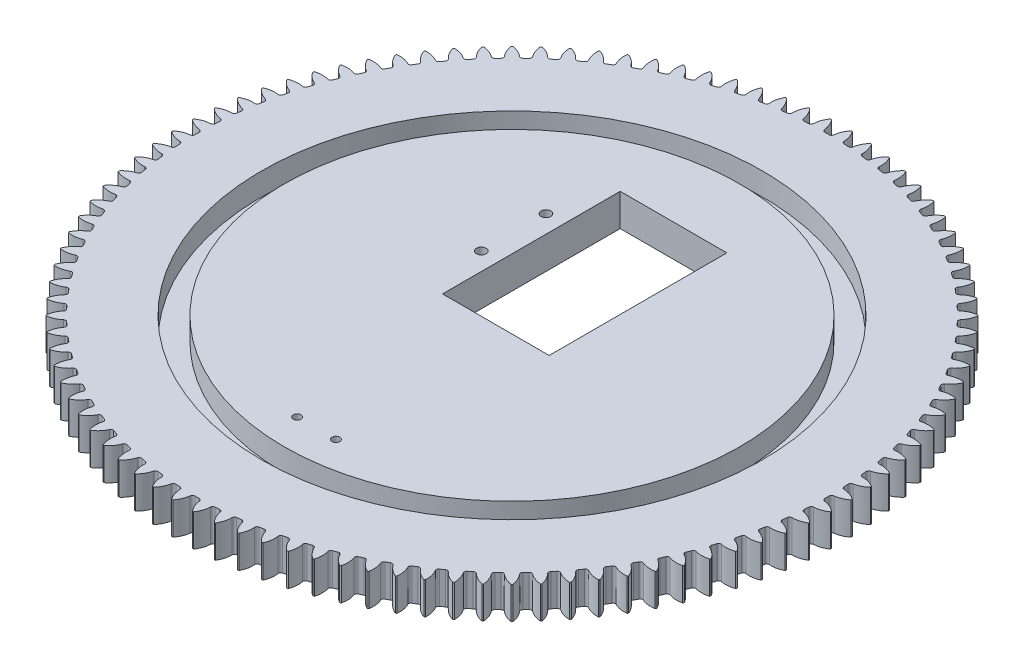
from build123d import *

# Parameters (mm, degrees)
SKETCH1_R                = 102
BOSS_EXTRUDE1_DEPTH      = 10
CUT_EXTRUDE1_DEPTH       = 145.595988879
FILLET1_R                = 0.76
CIRPATTERN2_COUNT        = 100
FILLET1_OF_CIRPATTERN2_R = 0.76
SKETCH3_R                = 77.5
SKETCH3_R_2              = 70.5
CUT_EXTRUDE2_DEPTH       = 7
SKETCH6_W                = 33
SKETCH6_H                = 55
CUT_EXTRUDE3_DEPTH       = 145.533117456
SKETCH7_W                = 42
SKETCH7_H                = 47
SKETCH7_R                = 12
SKETCH7_R_2              = 1.65
BOSS_EXTRUDE2_DEPTH      = 5
SKETCH9_W                = 42
SKETCH9_H                = 42
BOSS_EXTRUDE3_DEPTH      = 5
SKETCH10_R               = 1.2
CUT_EXTRUDE4_DEPTH       = 152.65362521
SKETCH11_R               = 1.5
CUT_EXTRUDE5_DEPTH       = 152.65362521


with BuildPart() as part:
    # Sketch1 → Boss-Extrude1 (new body)
    with BuildSketch(Plane(origin=(0, 0, 0), x_dir=(1, 0, 0), z_dir=(0, 1, 0))):
        with Locations(Location((0, 0, 0), (0, 0, 270))):
            Circle(SKETCH1_R)
    extrude(amount=BOSS_EXTRUDE1_DEPTH)

    # Sketch2 → Cut-Extrude1 (cut, through all)
    with BuildSketch(Plane(origin=(0, 10, 0), x_dir=(1, 0, 0), z_dir=(0, 1, 0))):
        with BuildLine():
            ThreePointArc((1.389546622, 97.490097755), (0, 97.5), (-1.389546622, 97.490097755))
            ThreePointArc((-1.389546622, 97.490097755), (-1.824876583, 99.860091271), (-3.014796953, 101.95543634))
            ThreePointArc((-3.014796953, 101.95543634), (0, 102), (3.014796953, 101.95543634))
            ThreePointArc((3.014796953, 101.95543634), (1.824876583, 99.860091271), (1.389546622, 97.490097755))
        make_face()
    cut_extrude1 = extrude(amount=-CUT_EXTRUDE1_DEPTH, mode=Mode.SUBTRACT)

    # Fillet1
    fillet1_edges = [part.edges().sort_by_distance(p)[0] for p in [
        (-1.389546622, 5, -97.490097755),
        (1.389546622, 5, -97.490097755),
    ]]
    fillet(fillet1_edges, radius=FILLET1_R)

    # CirPattern2: Cut-Extrude1 ×100 about axis
    cirpattern2_axis = Axis((0, 0, 0), (0, 1, 0))
    for i in range(1, CIRPATTERN2_COUNT):
        add(cut_extrude1.rotate(cirpattern2_axis, i * 360 / CIRPATTERN2_COUNT), mode=Mode.SUBTRACT)

    # Fillet1 of CirPattern2
    fillet1_of_cirpattern2_edges = [part.edges().sort_by_distance(p)[0] for p in [
        (-7.508258556, 5, -97.210472962),
        (-4.734649218, 5, -97.38497367),
        (-13.597338824, 5, -96.547202844),
        (-10.840159561, 5, -96.895515586),
        (-19.632756607, 5, -95.502905024),
        (-16.902888746, 5, -96.023655169),
        (-25.59069287, 5, -94.081700869),
        (-22.898909951, 5, -94.772833254),
        (-31.447634359, 5, -92.289199223),
        (-28.80455962, 5, -93.147986264),
        (-37.180466402, 5, -90.132474271),
        (-34.596530852, 5, -91.155526728),
        (-42.766564131, 5, -87.62003762),
        (-40.251965383, 5, -88.803317972),
        (-48.183881769, 5, -84.76180471),
        (-45.748543795, 5, -86.100643091),
        (-53.411039638, 5, -81.569055681),
        (-51.064573605, 5, -83.058168307),
        (-58.427408536, 5, -78.054390855),
        (-56.179074873, 5, -79.687900878),
        (-63.213191145, 5, -74.231681008),
        (-61.071862998, 5, -76.003141711),
        (-67.749500168, 5, -70.116012629),
        (-65.723628381, 5, -72.018432866),
        (-72.018432866, 5, -65.723628381),
        (-70.116012629, 5, -67.749500168),
        (-76.003141711, 5, -61.071862998),
        (-74.231681008, 5, -63.213191145),
        (-79.687900878, 5, -56.179074873),
        (-78.054390855, 5, -58.427408536),
        (-83.058168307, 5, -51.064573605),
        (-81.569055681, 5, -53.411039638),
        (-86.100643091, 5, -45.748543795),
        (-84.76180471, 5, -48.183881769),
        (-88.803317972, 5, -40.251965383),
        (-87.62003762, 5, -42.766564131),
        (-91.155526728, 5, -34.596530852),
        (-90.132474271, 5, -37.180466402),
        (-93.147986264, 5, -28.80455962),
        (-92.289199223, 5, -31.447634359),
        (-94.772833254, 5, -22.898909951),
        (-94.081700869, 5, -25.59069287),
        (-96.023655169, 5, -16.902888746),
        (-95.502905024, 5, -19.632756607),
        (-96.895515586, 5, -10.840159561),
        (-96.547202844, 5, -13.597338824),
        (-97.38497367, 5, -4.734649218),
        (-97.210472962, 5, -7.508258556),
        (-97.490097755, 5, 1.389546622),
        (-97.490097755, 5, -1.389546622),
        (-97.210472962, 5, 7.508258556),
        (-97.38497367, 5, 4.734649218),
        (-96.547202844, 5, 13.597338824),
        (-96.895515586, 5, 10.840159561),
        (-95.502905024, 5, 19.632756607),
        (-96.023655169, 5, 16.902888746),
        (-94.081700869, 5, 25.59069287),
        (-94.772833254, 5, 22.898909951),
        (-92.289199223, 5, 31.447634359),
        (-93.147986264, 5, 28.80455962),
        (-90.132474271, 5, 37.180466402),
        (-91.155526728, 5, 34.596530852),
        (-87.62003762, 5, 42.766564131),
        (-88.803317972, 5, 40.251965383),
        (-84.76180471, 5, 48.183881769),
        (-86.100643091, 5, 45.748543795),
        (-81.569055681, 5, 53.411039638),
        (-83.058168307, 5, 51.064573605),
        (-78.054390855, 5, 58.427408536),
        (-79.687900878, 5, 56.179074873),
        (-74.231681008, 5, 63.213191145),
        (-76.003141711, 5, 61.071862998),
        (-70.116012629, 5, 67.749500168),
        (-72.018432866, 5, 65.723628381),
        (-65.723628381, 5, 72.018432866),
        (-67.749500168, 5, 70.116012629),
        (-61.071862998, 5, 76.003141711),
        (-63.213191145, 5, 74.231681008),
        (-56.179074873, 5, 79.687900878),
        (-58.427408536, 5, 78.054390855),
        (-51.064573605, 5, 83.058168307),
        (-53.411039638, 5, 81.569055681),
        (-45.748543795, 5, 86.100643091),
        (-48.183881769, 5, 84.76180471),
        (-40.251965383, 5, 88.803317972),
        (-42.766564131, 5, 87.62003762),
        (-34.596530852, 5, 91.155526728),
        (-37.180466402, 5, 90.132474271),
        (-28.80455962, 5, 93.147986264),
        (-31.447634359, 5, 92.289199223),
        (-22.898909951, 5, 94.772833254),
        (-25.59069287, 5, 94.081700869),
        (-16.902888746, 5, 96.023655169),
        (-19.632756607, 5, 95.502905024),
        (-10.840159561, 5, 96.895515586),
        (-13.597338824, 5, 96.547202844),
        (-4.734649218, 5, 97.38497367),
        (-7.508258556, 5, 97.210472962),
        (1.389546622, 5, 97.490097755),
        (-1.389546622, 5, 97.490097755),
        (7.508258556, 5, 97.210472962),
        (4.734649218, 5, 97.38497367),
        (13.597338824, 5, 96.547202844),
        (10.840159561, 5, 96.895515586),
        (19.632756607, 5, 95.502905024),
        (16.902888746, 5, 96.023655169),
        (25.59069287, 5, 94.081700869),
        (22.898909951, 5, 94.772833254),
        (31.447634359, 5, 92.289199223),
        (28.80455962, 5, 93.147986264),
        (37.180466402, 5, 90.132474271),
        (34.596530852, 5, 91.155526728),
        (42.766564131, 5, 87.62003762),
        (40.251965383, 5, 88.803317972),
        (48.183881769, 5, 84.76180471),
        (45.748543795, 5, 86.100643091),
        (53.411039638, 5, 81.569055681),
        (51.064573605, 5, 83.058168307),
        (58.427408536, 5, 78.054390855),
        (56.179074873, 5, 79.687900878),
        (63.213191145, 5, 74.231681008),
        (61.071862998, 5, 76.003141711),
        (67.749500168, 5, 70.116012629),
        (65.723628381, 5, 72.018432866),
        (72.018432866, 5, 65.723628381),
        (70.116012629, 5, 67.749500168),
        (76.003141711, 5, 61.071862998),
        (74.231681008, 5, 63.213191145),
        (79.687900878, 5, 56.179074873),
        (78.054390855, 5, 58.427408536),
        (83.058168307, 5, 51.064573605),
        (81.569055681, 5, 53.411039638),
        (86.100643091, 5, 45.748543795),
        (84.76180471, 5, 48.183881769),
        (88.803317972, 5, 40.251965383),
        (87.62003762, 5, 42.766564131),
        (91.155526728, 5, 34.596530852),
        (90.132474271, 5, 37.180466402),
        (93.147986264, 5, 28.80455962),
        (92.289199223, 5, 31.447634359),
        (94.772833254, 5, 22.898909951),
        (94.081700869, 5, 25.59069287),
        (96.023655169, 5, 16.902888746),
        (95.502905024, 5, 19.632756607),
        (96.895515586, 5, 10.840159561),
        (96.547202844, 5, 13.597338824),
        (97.38497367, 5, 4.734649218),
        (97.210472962, 5, 7.508258556),
        (97.490097755, 5, -1.389546622),
        (97.490097755, 5, 1.389546622),
        (97.210472962, 5, -7.508258556),
        (97.38497367, 5, -4.734649218),
        (96.547202844, 5, -13.597338824),
        (96.895515586, 5, -10.840159561),
        (95.502905024, 5, -19.632756607),
        (96.023655169, 5, -16.902888746),
        (94.081700869, 5, -25.59069287),
        (94.772833254, 5, -22.898909951),
        (92.289199223, 5, -31.447634359),
        (93.147986264, 5, -28.80455962),
        (90.132474271, 5, -37.180466402),
        (91.155526728, 5, -34.596530852),
        (87.62003762, 5, -42.766564131),
        (88.803317972, 5, -40.251965383),
        (84.76180471, 5, -48.183881769),
        (86.100643091, 5, -45.748543795),
        (81.569055681, 5, -53.411039638),
        (83.058168307, 5, -51.064573605),
        (78.054390855, 5, -58.427408536),
        (79.687900878, 5, -56.179074873),
        (74.231681008, 5, -63.213191145),
        (76.003141711, 5, -61.071862998),
        (70.116012629, 5, -67.749500168),
        (72.018432866, 5, -65.723628381),
        (65.723628381, 5, -72.018432866),
        (67.749500168, 5, -70.116012629),
        (61.071862998, 5, -76.003141711),
        (63.213191145, 5, -74.231681008),
        (56.179074873, 5, -79.687900878),
        (58.427408536, 5, -78.054390855),
        (51.064573605, 5, -83.058168307),
        (53.411039638, 5, -81.569055681),
        (45.748543795, 5, -86.100643091),
        (48.183881769, 5, -84.76180471),
        (40.251965383, 5, -88.803317972),
        (42.766564131, 5, -87.62003762),
        (34.596530852, 5, -91.155526728),
        (37.180466402, 5, -90.132474271),
        (28.80455962, 5, -93.147986264),
        (31.447634359, 5, -92.289199223),
        (22.898909951, 5, -94.772833254),
        (25.59069287, 5, -94.081700869),
        (16.902888746, 5, -96.023655169),
        (19.632756607, 5, -95.502905024),
        (10.840159561, 5, -96.895515586),
        (13.597338824, 5, -96.547202844),
        (4.734649218, 5, -97.38497367),
        (7.508258556, 5, -97.210472962),
    ]]
    fillet(fillet1_of_cirpattern2_edges, radius=FILLET1_OF_CIRPATTERN2_R)

    # Sketch3 → Cut-Extrude2 (cut)
    with BuildSketch(Plane(origin=(0, 10, 0), x_dir=(1, 0, 0), z_dir=(0, 1, 0))):
        with Locations(Location((0, 0, 0), (0, 0, 270))):
            Circle(SKETCH3_R)
        with Locations(Location((0, 0, 0), (0, 0, 270))):
            Circle(SKETCH3_R_2, mode=Mode.SUBTRACT)
    extrude(amount=-CUT_EXTRUDE2_DEPTH, mode=Mode.SUBTRACT)

    # Sketch6 → Cut-Extrude3 (cut, through all)
    with BuildSketch(Plane.XZ):
        with Locations((0, -22.5)):
            Rectangle(SKETCH6_W, SKETCH6_H)
    extrude(amount=-CUT_EXTRUDE3_DEPTH, mode=Mode.SUBTRACT)

    # Sketch7 → Boss-Extrude2 (add)
    with BuildSketch(Plane(origin=(21.5, 0, 0), x_dir=(0, 0, -1), z_dir=(1, 0, 0))):
        with Locations((22.5, -23.5)):
            Rectangle(SKETCH7_W, SKETCH7_H)
        with Locations((22.5, -26)):
            Circle(SKETCH7_R, mode=Mode.SUBTRACT)
        with Locations((7, -10.5)):
            Circle(SKETCH7_R_2, mode=Mode.SUBTRACT)
        with Locations((38, -10.5)):
            Circle(SKETCH7_R_2, mode=Mode.SUBTRACT)
        with Locations((38, -41.5)):
            Circle(SKETCH7_R_2, mode=Mode.SUBTRACT)
        with Locations((7, -41.5)):
            Circle(SKETCH7_R_2, mode=Mode.SUBTRACT)
    extrude(amount=BOSS_EXTRUDE2_DEPTH)

    # Sketch9 → Boss-Extrude3 (add)
    with BuildSketch(Plane.XZ):
        with Locations((47.5, -22.5)):
            Rectangle(SKETCH9_W, SKETCH9_H)
    extrude(amount=BOSS_EXTRUDE3_DEPTH)

    # Sketch10 → Cut-Extrude4 (cut, through all)
    with BuildSketch(Plane.XZ):
        with Locations(Location((-6, 60.5, 0), (0, 0, 270))):
            Circle(SKETCH10_R)
        with Locations(Location((6, 60.5, 0), (0, 0, 270))):
            Circle(SKETCH10_R)
    extrude(amount=-CUT_EXTRUDE4_DEPTH, mode=Mode.SUBTRACT)

    # Sketch11 → Cut-Extrude5 (cut, through all)
    with BuildSketch(Plane.XZ):
        with Locations(Location((-22, -12.5, 0), (0, 0, 270))):
            Circle(SKETCH11_R)
        with Locations(Location((-22, -32.5, 0), (0, 0, 270))):
            Circle(SKETCH11_R)
    extrude(amount=-CUT_EXTRUDE5_DEPTH, mode=Mode.SUBTRACT)


solid = part.part
